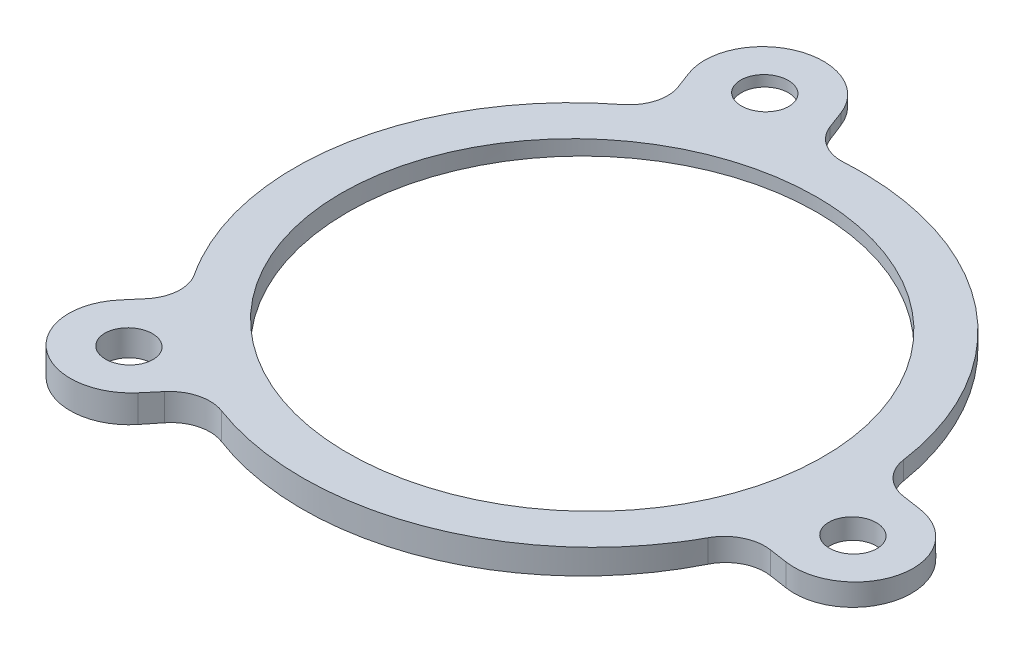
from build123d import *

# Parameters (mm, degrees)
BOSS_EXTRUDE1_REACH = 49.636
SKETCH2_R           = 12
SKETCH2_R_2         = 1.2


with BuildPart() as part:
    # Boss-Extrude1: up to this plane
    boss_extrude1_end = Plane(origin=(0, 0.999249336, -0.027387955), z_dir=(0, 0.9996245977511439, -0.027398240287721646))
    # Sketch2 → Boss-Extrude1 (new, up to the surface)
    with BuildSketch(Plane(origin=(0, 0, 0), x_dir=(1, 0, 0), z_dir=(0, 1, 0)), mode=Mode.PRIVATE) as boss_extrude1_sk1:
        with BuildLine():
            Line((-8.813634389, 14.267790609), (-8.460765596, 13.367375576))
            ThreePointArc((-8.460765596, 13.367375576), (-8.388150437, 12.130835815), (-9.05764982, 11.088687016))
            ThreePointArc((-9.05764982, 11.088687016), (-14.156836939, 2.14102029), (-11.931590899, -7.914362805))
            ThreePointArc((-11.931590899, -7.914362805), (-11.600204415, -9.107881359), (-12.035226867, -10.267648149))
            Line((-12.035226867, -10.267648149), (-12.638574763, -11.023449005))
            ThreePointArc((-12.638574763, -11.023449005), (-12.165652136, -15.239649212), (-7.949451928, -14.766726585))
            Line((-7.949451928, -14.766726585), (-7.346104032, -14.01092573))
            ThreePointArc((-7.346104032, -14.01092573), (-6.311536766, -13.329769277), (-5.074259741, -13.38849835))
            ThreePointArc((-5.074259741, -13.38849835), (5.224240508, -13.330690571), (12.819834694, -6.375879424))
            ThreePointArc((12.819834694, -6.375879424), (13.687758839, -5.492131033), (14.909657568, -5.288988132))
            Line((14.909657568, -5.288988132), (15.865874257, -5.43360231))
            ThreePointArc((15.865874257, -5.43360231), (19.28074943, -2.915939197), (16.763086318, 0.498935976))
            Line((16.763086318, 0.498935976), (15.806869628, 0.643550154))
            ThreePointArc((15.806869628, 0.643550154), (14.699687203, 1.198933462), (14.131909561, 2.299811334))
            ThreePointArc((14.131909561, 2.299811334), (8.932596431, 11.189670281), (-0.888243794, 14.290242229))
            ThreePointArc((-0.888243794, 14.290242229), (-2.087554424, 14.600012392), (-2.874430701, 15.556636282))
            Line((-2.874430701, 15.556636282), (-3.227299494, 16.457051315))
            ThreePointArc((-3.227299494, 16.457051315), (-7.115097295, 18.155588409), (-8.813634389, 14.267790609))
        make_face()
        Circle(SKETCH2_R, mode=Mode.SUBTRACT)
        with Locations((-6.020466942, 15.362420962)):
            Circle(SKETCH2_R_2, mode=Mode.SUBTRACT)
        with Locations((16.314480287, -2.467333167)):
            Circle(SKETCH2_R_2, mode=Mode.SUBTRACT)
        with Locations((-10.294013346, -12.895087795)):
            Circle(SKETCH2_R_2, mode=Mode.SUBTRACT)
    boss_extrude1_tool1 = split(extrude(boss_extrude1_sk1.sketch, amount=BOSS_EXTRUDE1_REACH, mode=Mode.PRIVATE), bisect_by=boss_extrude1_end, keep=Keep.BOTH, mode=Mode.PRIVATE)
    add(boss_extrude1_tool1.solids().sort_by_distance((-2.345651, 0, -14.19522))[0])


solid = part.part
